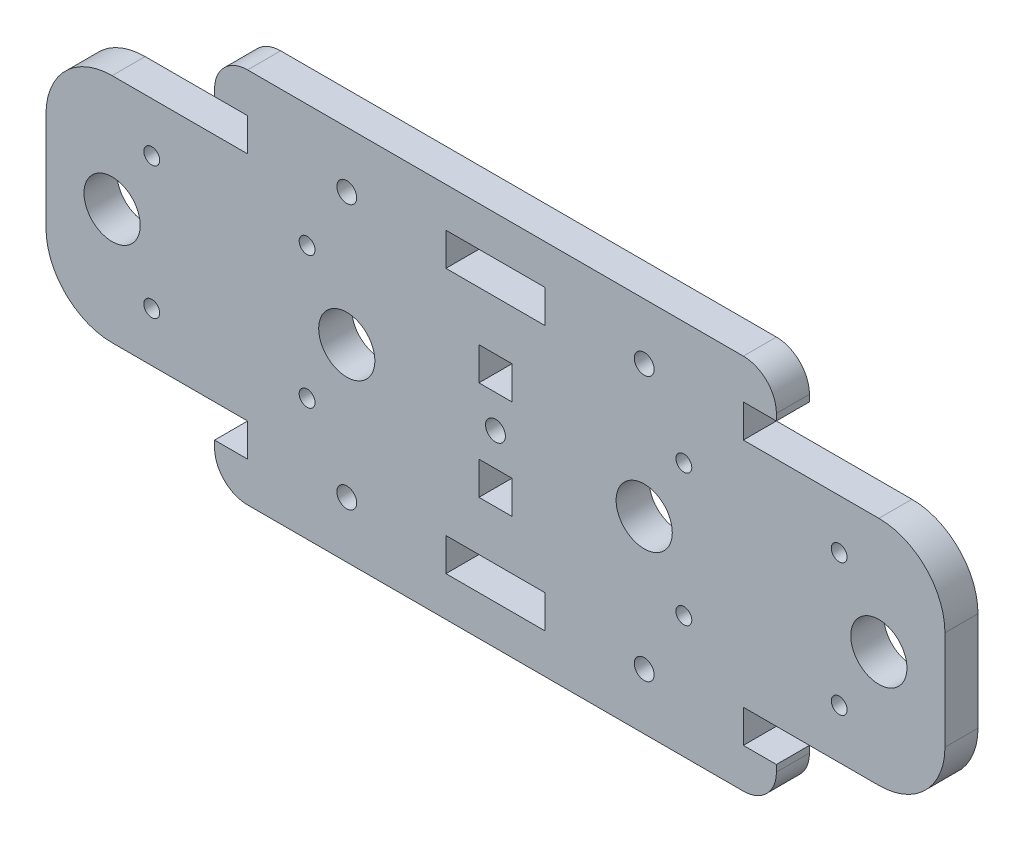
from build123d import *

# Parameters (mm, degrees)
ESQUISSE1_R        = 1.5
ESQUISSE1_R_2      = 4.25
ESQUISSE1_R_3      = 1.2
ESQUISSE1_W        = 5
ESQUISSE1_H        = 5
BOSS_EXTRU_1_DEPTH = 5
CONG_1_R           = 5
CONG_2_R           = 10


with BuildPart() as part:
    # Esquisse1 → Boss.-Extru.1 (new body)
    with BuildSketch(Plane.XY):
        Polygon((-20, 0), (20, 0), (20, 6), (15, 6), (15, 11), (20, 11), (45.5, 11), (45.5, 46), (20, 46), (15, 46), (15, 51), (20, 51), (20, 57), (-20, 57), (-25, 57), (-65, 57), (-65, 51), (-60, 51), (-60, 46), (-65, 46), (-90.5, 46), (-90.5, 11), (-65, 11), (-60, 11), (-60, 6), (-65, 6), (-65, 0), (-25, 0), align=None)
        with Locations((0, 48.5)):
            Circle(ESQUISSE1_R, mode=Mode.SUBTRACT)
        with Locations((0, 8.5)):
            Circle(ESQUISSE1_R, mode=Mode.SUBTRACT)
        with Locations((0, 28.5)):
            Circle(ESQUISSE1_R_2, mode=Mode.SUBTRACT)
        with Locations((-45, 8.5)):
            Circle(ESQUISSE1_R, mode=Mode.SUBTRACT)
        with Locations((-45, 28.5)):
            Circle(ESQUISSE1_R_2, mode=Mode.SUBTRACT)
        with Locations((-45, 48.5)):
            Circle(ESQUISSE1_R, mode=Mode.SUBTRACT)
        with Locations((6, 38.5)):
            Circle(ESQUISSE1_R_3, mode=Mode.SUBTRACT)
        with Locations((6, 18.5)):
            Circle(ESQUISSE1_R_3, mode=Mode.SUBTRACT)
        with Locations((-51, 18.5)):
            Circle(ESQUISSE1_R_3, mode=Mode.SUBTRACT)
        with Locations((-51, 38.5)):
            Circle(ESQUISSE1_R_3, mode=Mode.SUBTRACT)
        with Locations((35.5, 28.5)):
            Circle(ESQUISSE1_R_2, mode=Mode.SUBTRACT)
        with Locations((-80.5, 28.5)):
            Circle(ESQUISSE1_R_2, mode=Mode.SUBTRACT)
        with Locations((29.5, 38.5)):
            Circle(ESQUISSE1_R_3, mode=Mode.SUBTRACT)
        with Locations((29.5, 18.5)):
            Circle(ESQUISSE1_R_3, mode=Mode.SUBTRACT)
        with Locations((-74.5, 18.5)):
            Circle(ESQUISSE1_R_3, mode=Mode.SUBTRACT)
        with Locations((-74.5, 38.5)):
            Circle(ESQUISSE1_R_3, mode=Mode.SUBTRACT)
        with Locations((-22.5, 28.5)):
            Circle(ESQUISSE1_R, mode=Mode.SUBTRACT)
        Polygon((-20, 51), (-15, 51), (-15, 46), (-20, 46), (-25, 46), (-30, 46), (-30, 51), (-25, 51), align=None, mode=Mode.SUBTRACT)
        Polygon((-20, 11), (-15, 11), (-15, 6), (-20, 6), (-25, 6), (-30, 6), (-30, 11), (-25, 11), align=None, mode=Mode.SUBTRACT)
        with Locations((-22.5, 21)):
            Rectangle(ESQUISSE1_W, ESQUISSE1_H, mode=Mode.SUBTRACT)
        with Locations((-22.5, 36)):
            Rectangle(ESQUISSE1_W, ESQUISSE1_H, mode=Mode.SUBTRACT)
    extrude(amount=BOSS_EXTRU_1_DEPTH)

    # Congé1
    cong_1_edges = [part.edges().sort_by_distance(p)[0] for p in [
        (20, 57, 2.5),
        (20, 0, 2.5),
        (-65, 0, 2.5),
        (-65, 57, 2.5),
    ]]
    fillet(cong_1_edges, radius=CONG_1_R)

    # Congé2
    cong_2_edges = [part.edges().sort_by_distance(p)[0] for p in [
        (-90.5, 11, 2.5),
        (-90.5, 46, 2.5),
        (45.5, 11, 2.5),
        (45.5, 46, 2.5),
    ]]
    fillet(cong_2_edges, radius=CONG_2_R)


solid = part.part
